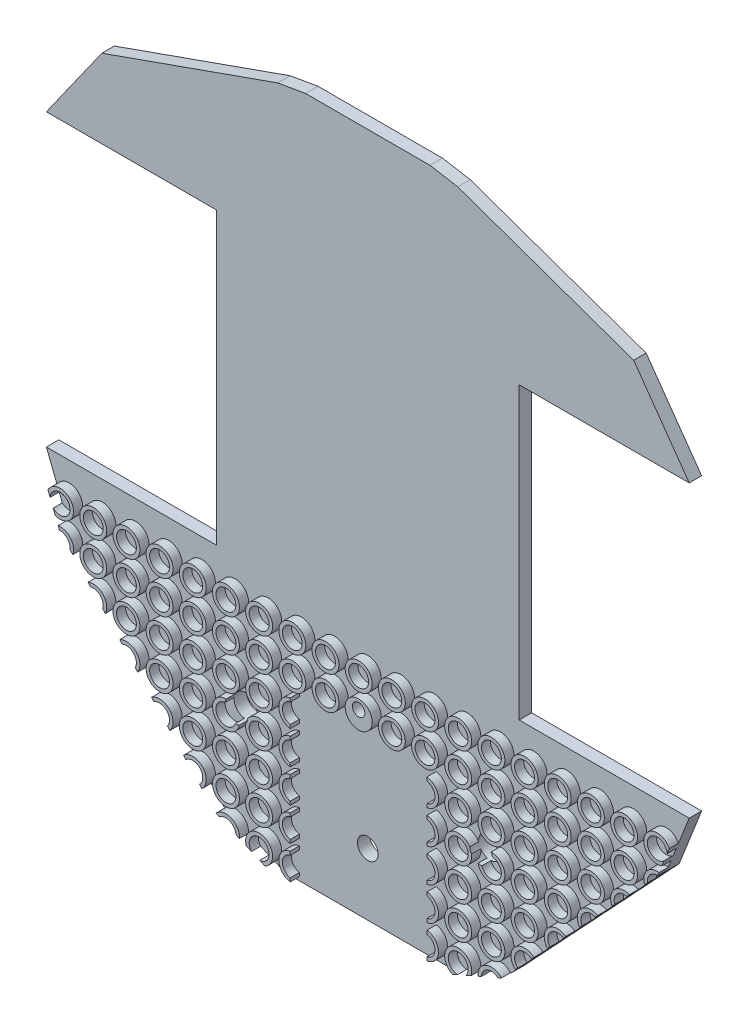
from build123d import *

# Parameters (mm, degrees)
ESBO_O1_W                   = 20.07664266
ESBO_O1_H                   = 70
ESBO_O1_W_2                 = 40
ESBO_O1_H_2                 = 20.07664266
ESBO_O1_W_3                 = 30
RESSALTO_EXTRUS_O1_DEPTH    = 3
ESBO_O2_W                   = 20.003049531
ESBO_O2_H                   = 70
ESBO_O2_W_2                 = 21
ESBO_O2_H_2                 = 35
CORTE_EXTRUS_O1_DEPTH       = 123.700002715
ESBO_O3_R                   = 1.5
ESBO_O3_R_2                 = 2.5
ESBO_O3_R_3                 = 2.75
CORTE_EXTRUS_O2_DEPTH       = 123.700002715
ESBO_O5_R                   = 3.255
ESBO_O5_R_2                 = 2.4
RESSALTO_EXTRUS_O2_DEPTH    = 2.2
CORTE_EXTRUS_O3_OUTLINE_R   = 3.255
CORTE_EXTRUS_O3_OUTLINE_R_2 = 2.4
CORTE_EXTRUS_O3_DEPTH       = 2.2
CORTE_EXTRUS_O4_START       = -28.2
ESBO_O8_R                   = 2.75
ESBO_O8_R_2                 = 1.5
CORTE_EXTRUS_O4_DEPTH       = 28.2


# Read off the part's stored shape, not the designer's step: Corte-extrusão3
with BuildPart() as part:
    # Esboço1 → Ressalto-extrusão1 (new body)
    with BuildSketch(Plane.XY):
        Polygon((-21.69221422, 68.928440225), (-15, 50), (-57.426406871, 35), (-64.118621091, 53.928440225), align=None)
        Polygon((-57.426406871, 35), (-64.118621091, 53.928440225), (-77.503049531, 35), align=None)
        with Locations((-67.464728201, 0)):
            Rectangle(ESBO_O1_W, ESBO_O1_H)
        Polygon((-77.503049531, -35), (-57.426406871, -35), (-72.086515595, -48.716879846), align=None)
        Polygon((-72.086515595, -48.716879846), (-34.660108723, -88.716879846), (-20, -75), (-57.426406871, -35), align=None)
        Polygon((-57.426406871, 0), (0, 0), (0, 50), (-15, 50), (-57.426406871, 35), align=None)
        Polygon((-34.660108723, -88.716879846), (-20, -75), (-20, -95.07664266), align=None)
        Polygon((0, -75), (0, 0), (-57.426406871, 0), (-57.426406871, -35), (-20, -75), align=None)
        with Locations((0, -85.03832133)):
            Rectangle(ESBO_O1_W_2, ESBO_O1_H_2)
        Polygon((0, 50), (0, 0), (0, -75), (20, -75), (57.426406871, -35), (57.426406871, 35), (15, 50), align=None)
        Polygon((34.660108723, -88.716879846), (20, -75), (20, -95.07664266), align=None)
        Polygon((57.426406871, -35), (72.086515595, -48.716879846), (34.660108723, -88.716879846), (20, -75), align=None)
        with Locations((67.464728201, 0)):
            Rectangle(ESBO_O1_W, ESBO_O1_H)
        Polygon((77.503049531, -35), (72.086515595, -48.716879846), (57.426406871, -35), align=None)
        Polygon((57.426406871, 35), (64.118621091, 53.928440225), (77.503049531, 35), align=None)
        Polygon((21.69221422, 68.928440225), (15, 50), (57.426406871, 35), (64.118621091, 53.928440225), align=None)
        with Locations((0, 60.03832133)):
            Rectangle(ESBO_O1_W_3, ESBO_O1_H_2)
        Polygon((15, 50), (15, 70.07664266), (21.69221422, 68.928440225), align=None)
        Polygon((-21.69221422, 68.928440225), (-15, 70.07664266), (-15, 50), align=None)
    extrude(amount=RESSALTO_EXTRUS_O1_DEPTH)

    # Esboço2 → Corte-extrusão1 (cut, through all)
    with BuildSketch(Plane.XY.offset(3)):
        with Locations((-67.501524766, 0)):
            Rectangle(ESBO_O2_W, ESBO_O2_H)
        with Locations((-47, 17.5)):
            Rectangle(ESBO_O2_W_2, ESBO_O2_H_2)
        with Locations((-47, -17.5)):
            Rectangle(ESBO_O2_W_2, ESBO_O2_H_2)
        with Locations((47, 0)):
            Rectangle(ESBO_O2_W_2, ESBO_O2_H)
        with Locations((67.501524766, 0)):
            Rectangle(ESBO_O2_W, ESBO_O2_H)
    extrude(amount=-CORTE_EXTRUS_O1_DEPTH, mode=Mode.SUBTRACT)

    # Esboço3 → Corte-extrusão2 (cut, through all)
    with BuildSketch(Plane.XY.offset(3)):
        with Locations((0, -50)):
            Circle(ESBO_O3_R)
        with Locations((0, -80.07664266)):
            Circle(ESBO_O3_R_2)
        with Locations((-29.5, -65)):
            Circle(ESBO_O3_R_3)
        with Locations((29.5, -65)):
            Circle(ESBO_O3_R_3)
    extrude(amount=-CORTE_EXTRUS_O2_DEPTH, mode=Mode.SUBTRACT)

    # Esboço5 → Ressalto-extrusão2 (add)
    # profile 1 of 133: a face of its own
    with BuildSketch(Plane.XY.offset(3)):
        with Locations((0, -43.002961071)):
            Circle(ESBO_O5_R)
        with Locations((0, -43.002961071)):
            Circle(ESBO_O5_R_2, mode=Mode.SUBTRACT)
    # profile 2 of 133: a face of its own
    with BuildSketch(Plane.XY.offset(3)):
        with Locations((8, -43.002961071)):
            Circle(ESBO_O5_R)
        with Locations((8, -43.002961071)):
            Circle(ESBO_O5_R_2, mode=Mode.SUBTRACT)
    # profile 3 of 133: a face of its own
    with BuildSketch(Plane.XY.offset(3)):
        with Locations((16, -43.002961071)):
            Circle(ESBO_O5_R)
        with Locations((16, -43.002961071)):
            Circle(ESBO_O5_R_2, mode=Mode.SUBTRACT)
    # profile 4 of 133: a face of its own
    with BuildSketch(Plane.XY.offset(3)):
        with Locations((24, -43.002961071)):
            Circle(ESBO_O5_R)
        with Locations((24, -43.002961071)):
            Circle(ESBO_O5_R_2, mode=Mode.SUBTRACT)
    # profile 5 of 133: a face of its own
    with BuildSketch(Plane.XY.offset(3)):
        with Locations((32, -43.002961071)):
            Circle(ESBO_O5_R)
        with Locations((32, -43.002961071)):
            Circle(ESBO_O5_R_2, mode=Mode.SUBTRACT)
    # profile 6 of 133: a face of its own
    with BuildSketch(Plane.XY.offset(3)):
        with Locations((40, -43.002961071)):
            Circle(ESBO_O5_R)
        with Locations((40, -43.002961071)):
            Circle(ESBO_O5_R_2, mode=Mode.SUBTRACT)
    # profile 7 of 133: a face of its own
    with BuildSketch(Plane.XY.offset(3)):
        with Locations((48, -43.002961071)):
            Circle(ESBO_O5_R)
        with Locations((48, -43.002961071)):
            Circle(ESBO_O5_R_2, mode=Mode.SUBTRACT)
    # profile 8 of 133: a face of its own
    with BuildSketch(Plane.XY.offset(3)):
        with Locations((56, -43.002961071)):
            Circle(ESBO_O5_R)
        with Locations((56, -43.002961071)):
            Circle(ESBO_O5_R_2, mode=Mode.SUBTRACT)
    # profile 9 of 133: a face of its own
    with BuildSketch(Plane.XY.offset(3)):
        with Locations((64, -43.002961071)):
            Circle(ESBO_O5_R)
        with Locations((64, -43.002961071)):
            Circle(ESBO_O5_R_2, mode=Mode.SUBTRACT)
    # profile 10 of 133: a face of its own
    with BuildSketch(Plane.XY.offset(3)):
        with Locations(Location((72, -43.002961071, 0), (0, 0, 290.477256302))):
            Circle(ESBO_O5_R)
        with Locations(Location((72, -43.002961071, 0), (0, 0, 313.676093483))):
            Circle(ESBO_O5_R_2, mode=Mode.SUBTRACT)
    # profile 11 of 133: a face of its own
    with BuildSketch(Plane.XY.offset(3)):
        with Locations((8, -51.002961071)):
            Circle(ESBO_O5_R)
        with Locations((8, -51.002961071)):
            Circle(ESBO_O5_R_2, mode=Mode.SUBTRACT)
    # profile 12 of 133: a face of its own
    with BuildSketch(Plane.XY.offset(3)):
        with Locations((16, -51.002961071)):
            Circle(ESBO_O5_R)
        with Locations((16, -51.002961071)):
            Circle(ESBO_O5_R_2, mode=Mode.SUBTRACT)
    # profile 13 of 133: a face of its own
    with BuildSketch(Plane.XY.offset(3)):
        with Locations((24, -51.002961071)):
            Circle(ESBO_O5_R)
        with Locations((24, -51.002961071)):
            Circle(ESBO_O5_R_2, mode=Mode.SUBTRACT)
    # profile 14 of 133: a face of its own
    with BuildSketch(Plane.XY.offset(3)):
        with Locations((32, -51.002961071)):
            Circle(ESBO_O5_R)
        with Locations((32, -51.002961071)):
            Circle(ESBO_O5_R_2, mode=Mode.SUBTRACT)
    # profile 15 of 133: a face of its own
    with BuildSketch(Plane.XY.offset(3)):
        with Locations((40, -51.002961071)):
            Circle(ESBO_O5_R)
        with Locations((40, -51.002961071)):
            Circle(ESBO_O5_R_2, mode=Mode.SUBTRACT)
    # profile 16 of 133: a face of its own
    with BuildSketch(Plane.XY.offset(3)):
        with Locations((48, -51.002961071)):
            Circle(ESBO_O5_R)
        with Locations((48, -51.002961071)):
            Circle(ESBO_O5_R_2, mode=Mode.SUBTRACT)
    # profile 17 of 133: a face of its own
    with BuildSketch(Plane.XY.offset(3)):
        with Locations((56, -51.002961071)):
            Circle(ESBO_O5_R)
        with Locations((56, -51.002961071)):
            Circle(ESBO_O5_R_2, mode=Mode.SUBTRACT)
    # profile 18 of 133: a face of its own
    with BuildSketch(Plane.XY.offset(3)):
        with Locations((64, -51.002961071)):
            Circle(ESBO_O5_R)
        with Locations((64, -51.002961071)):
            Circle(ESBO_O5_R_2, mode=Mode.SUBTRACT)
    # profile 19 of 133: a face of its own
    with BuildSketch(Plane.XY.offset(3)):
        with Locations(Location((72, -51.002961071, 0), (0, 0, 199.488200522))):
            Circle(ESBO_O5_R)
        with Locations(Location((72, -51.002961071, 0), (0, 0, 188.260244767))):
            Circle(ESBO_O5_R_2, mode=Mode.SUBTRACT)
    # profile 20 of 133: a face of its own
    with BuildSketch(Plane.XY.offset(3)):
        with Locations((8, -59.002961071)):
            Circle(ESBO_O5_R)
        with Locations((8, -59.002961071)):
            Circle(ESBO_O5_R_2, mode=Mode.SUBTRACT)
    # profile 21 of 133: a face of its own
    with BuildSketch(Plane.XY.offset(3)):
        with Locations((16, -59.002961071)):
            Circle(ESBO_O5_R)
        with Locations((16, -59.002961071)):
            Circle(ESBO_O5_R_2, mode=Mode.SUBTRACT)
    # profile 22 of 133: a face of its own
    with BuildSketch(Plane.XY.offset(3)):
        with Locations((24, -59.002961071)):
            Circle(ESBO_O5_R)
        with Locations((24, -59.002961071)):
            Circle(ESBO_O5_R_2, mode=Mode.SUBTRACT)
    # profile 23 of 133: a face of its own
    with BuildSketch(Plane.XY.offset(3)):
        with Locations((32, -59.002961071)):
            Circle(ESBO_O5_R)
        with Locations((32, -59.002961071)):
            Circle(ESBO_O5_R_2, mode=Mode.SUBTRACT)
    # profile 24 of 133: a face of its own
    with BuildSketch(Plane.XY.offset(3)):
        with Locations((40, -59.002961071)):
            Circle(ESBO_O5_R)
        with Locations((40, -59.002961071)):
            Circle(ESBO_O5_R_2, mode=Mode.SUBTRACT)
    # profile 25 of 133: a face of its own
    with BuildSketch(Plane.XY.offset(3)):
        with Locations((48, -59.002961071)):
            Circle(ESBO_O5_R)
        with Locations((48, -59.002961071)):
            Circle(ESBO_O5_R_2, mode=Mode.SUBTRACT)
    # profile 26 of 133: a face of its own
    with BuildSketch(Plane.XY.offset(3)):
        with Locations((56, -59.002961071)):
            Circle(ESBO_O5_R)
        with Locations((56, -59.002961071)):
            Circle(ESBO_O5_R_2, mode=Mode.SUBTRACT)
    # profile 27 of 133: a face of its own
    with BuildSketch(Plane.XY.offset(3)):
        with Locations(Location((64, -59.002961071, 0), (0, 0, 206.723675231))):
            Circle(ESBO_O5_R)
        with Locations(Location((64, -59.002961071, 0), (0, 0, 199.007749565))):
            Circle(ESBO_O5_R_2, mode=Mode.SUBTRACT)
    # profile 28 of 133: a face of its own
    with BuildSketch(Plane.XY.offset(3)):
        with Locations((72, -59.002961071)):
            Circle(ESBO_O5_R)
        with Locations((72, -59.002961071)):
            Circle(ESBO_O5_R_2, mode=Mode.SUBTRACT)
    # profile 29 of 133: a face of its own
    with BuildSketch(Plane.XY.offset(3)):
        with Locations((8, -67.002961071)):
            Circle(ESBO_O5_R)
        with Locations((8, -67.002961071)):
            Circle(ESBO_O5_R_2, mode=Mode.SUBTRACT)
    # profile 30 of 133: a face of its own
    with BuildSketch(Plane.XY.offset(3)):
        with Locations((16, -67.002961071)):
            Circle(ESBO_O5_R)
        with Locations((16, -67.002961071)):
            Circle(ESBO_O5_R_2, mode=Mode.SUBTRACT)
    # profile 31 of 133: a face of its own
    with BuildSketch(Plane.XY.offset(3)):
        with Locations(Location((24, -67.002961071, 0), (0, 0, 31.852518549))):
            Circle(ESBO_O5_R)
        with Locations((24, -67.002961071)):
            Circle(ESBO_O5_R_2, mode=Mode.SUBTRACT)
    # profile 32 of 133: a face of its own
    with BuildSketch(Plane.XY.offset(3)):
        with Locations(Location((32, -67.002961071, 0), (0, 0, 191.693843813))):
            Circle(ESBO_O5_R)
        with Locations(Location((32, -67.002961071, 0), (0, 0, 197.921366549))):
            Circle(ESBO_O5_R_2, mode=Mode.SUBTRACT)
    # profile 33 of 133: a face of its own
    with BuildSketch(Plane.XY.offset(3)):
        with Locations((40, -67.002961071)):
            Circle(ESBO_O5_R)
        with Locations((40, -67.002961071)):
            Circle(ESBO_O5_R_2, mode=Mode.SUBTRACT)
    # profile 34 of 133: a face of its own
    with BuildSketch(Plane.XY.offset(3)):
        with Locations((48, -67.002961071)):
            Circle(ESBO_O5_R)
        with Locations((48, -67.002961071)):
            Circle(ESBO_O5_R_2, mode=Mode.SUBTRACT)
    # profile 35 of 133: a face of its own
    with BuildSketch(Plane.XY.offset(3)):
        with Locations(Location((56, -67.002961071, 0), (0, 0, 213.635942436))):
            Circle(ESBO_O5_R)
        with Locations(Location((56, -67.002961071, 0), (0, 0, 208.768363454))):
            Circle(ESBO_O5_R_2, mode=Mode.SUBTRACT)
    # profile 36 of 133: a face of its own
    with BuildSketch(Plane.XY.offset(3)):
        with Locations((64, -67.002961071)):
            Circle(ESBO_O5_R)
        with Locations((64, -67.002961071)):
            Circle(ESBO_O5_R_2, mode=Mode.SUBTRACT)
    # profile 37 of 133: a face of its own
    with BuildSketch(Plane.XY.offset(3)):
        with Locations((72, -67.002961071)):
            Circle(ESBO_O5_R)
        with Locations((72, -67.002961071)):
            Circle(ESBO_O5_R_2, mode=Mode.SUBTRACT)
    # profile 38 of 133: a face of its own
    with BuildSketch(Plane.XY.offset(3)):
        with Locations((8, -75.002961071)):
            Circle(ESBO_O5_R)
        with Locations((8, -75.002961071)):
            Circle(ESBO_O5_R_2, mode=Mode.SUBTRACT)
    # profile 39 of 133: a face of its own
    with BuildSketch(Plane.XY.offset(3)):
        with Locations((16, -75.002961071)):
            Circle(ESBO_O5_R)
        with Locations((16, -75.002961071)):
            Circle(ESBO_O5_R_2, mode=Mode.SUBTRACT)
    # profile 40 of 133: a face of its own
    with BuildSketch(Plane.XY.offset(3)):
        with Locations((24, -75.002961071)):
            Circle(ESBO_O5_R)
        with Locations((24, -75.002961071)):
            Circle(ESBO_O5_R_2, mode=Mode.SUBTRACT)
    # profile 41 of 133: a face of its own
    with BuildSketch(Plane.XY.offset(3)):
        with Locations((32, -75.002961071)):
            Circle(ESBO_O5_R)
        with Locations((32, -75.002961071)):
            Circle(ESBO_O5_R_2, mode=Mode.SUBTRACT)
    # profile 42 of 133: a face of its own
    with BuildSketch(Plane.XY.offset(3)):
        with Locations((40, -75.002961071)):
            Circle(ESBO_O5_R)
        with Locations((40, -75.002961071)):
            Circle(ESBO_O5_R_2, mode=Mode.SUBTRACT)
    # profile 43 of 133: a face of its own
    with BuildSketch(Plane.XY.offset(3)):
        with Locations(Location((48, -75.002961071, 0), (0, 0, 220.355838596))):
            Circle(ESBO_O5_R)
        with Locations(Location((48, -75.002961071, 0), (0, 0, 218.006745936))):
            Circle(ESBO_O5_R_2, mode=Mode.SUBTRACT)
    # profile 44 of 133: a face of its own
    with BuildSketch(Plane.XY.offset(3)):
        with Locations((56, -75.002961071)):
            Circle(ESBO_O5_R)
        with Locations((56, -75.002961071)):
            Circle(ESBO_O5_R_2, mode=Mode.SUBTRACT)
    # profile 45 of 133: a face of its own
    with BuildSketch(Plane.XY.offset(3)):
        with Locations((64, -75.002961071)):
            Circle(ESBO_O5_R)
        with Locations((64, -75.002961071)):
            Circle(ESBO_O5_R_2, mode=Mode.SUBTRACT)
    # profile 46 of 133: a face of its own
    with BuildSketch(Plane.XY.offset(3)):
        with Locations((72, -75.002961071)):
            Circle(ESBO_O5_R)
        with Locations((72, -75.002961071)):
            Circle(ESBO_O5_R_2, mode=Mode.SUBTRACT)
    # profile 47 of 133: a face of its own
    with BuildSketch(Plane.XY.offset(3)):
        with Locations((8, -83.002961071)):
            Circle(ESBO_O5_R)
        with Locations((8, -83.002961071)):
            Circle(ESBO_O5_R_2, mode=Mode.SUBTRACT)
    # profile 48 of 133: a face of its own
    with BuildSketch(Plane.XY.offset(3)):
        with Locations((16, -83.002961071)):
            Circle(ESBO_O5_R)
        with Locations((16, -83.002961071)):
            Circle(ESBO_O5_R_2, mode=Mode.SUBTRACT)
    # profile 49 of 133: a face of its own
    with BuildSketch(Plane.XY.offset(3)):
        with Locations((24, -83.002961071)):
            Circle(ESBO_O5_R)
        with Locations((24, -83.002961071)):
            Circle(ESBO_O5_R_2, mode=Mode.SUBTRACT)
    # profile 50 of 133: a face of its own
    with BuildSketch(Plane.XY.offset(3)):
        with Locations((32, -83.002961071)):
            Circle(ESBO_O5_R)
        with Locations((32, -83.002961071)):
            Circle(ESBO_O5_R_2, mode=Mode.SUBTRACT)
    # profile 51 of 133: a face of its own
    with BuildSketch(Plane.XY.offset(3)):
        with Locations(Location((40, -83.002961071, 0), (0, 0, 226.985962702))):
            Circle(ESBO_O5_R)
        with Locations(Location((40, -83.002961071, 0), (0, 0, 227.015245336))):
            Circle(ESBO_O5_R_2, mode=Mode.SUBTRACT)
    # profile 52 of 133: a face of its own
    with BuildSketch(Plane.XY.offset(3)):
        with Locations((48, -83.002961071)):
            Circle(ESBO_O5_R)
        with Locations((48, -83.002961071)):
            Circle(ESBO_O5_R_2, mode=Mode.SUBTRACT)
    # profile 53 of 133: a face of its own
    with BuildSketch(Plane.XY.offset(3)):
        with Locations((56, -83.002961071)):
            Circle(ESBO_O5_R)
        with Locations((56, -83.002961071)):
            Circle(ESBO_O5_R_2, mode=Mode.SUBTRACT)
    # profile 54 of 133: a face of its own
    with BuildSketch(Plane.XY.offset(3)):
        with Locations((64, -83.002961071)):
            Circle(ESBO_O5_R)
        with Locations((64, -83.002961071)):
            Circle(ESBO_O5_R_2, mode=Mode.SUBTRACT)
    # profile 55 of 133: a face of its own
    with BuildSketch(Plane.XY.offset(3)):
        with Locations((72, -83.002961071)):
            Circle(ESBO_O5_R)
        with Locations((72, -83.002961071)):
            Circle(ESBO_O5_R_2, mode=Mode.SUBTRACT)
    # profile 56 of 133: a face of its own
    with BuildSketch(Plane.XY.offset(3)):
        with Locations((0, -51.002961071)):
            Circle(ESBO_O5_R)
    # profile 57 of 133: a face of its own
    with BuildSketch(Plane.XY.offset(3)):
        with Locations((0, -59.002961071)):
            Circle(ESBO_O5_R)
    # profile 58 of 133: a face of its own
    with BuildSketch(Plane.XY.offset(3)):
        with Locations((0, -67.002961071)):
            Circle(ESBO_O5_R)
    # profile 59 of 133: a face of its own
    with BuildSketch(Plane.XY.offset(3)):
        with Locations(Location((0, -75.002961071, 0), (0, 0, 245.632318391))):
            Circle(ESBO_O5_R)
    # profile 60 of 133: a face of its own
    with BuildSketch(Plane.XY.offset(3)):
        with Locations(Location((0, -83.002961071, 0), (0, 0, 137.344194985))):
            Circle(ESBO_O5_R)
    # profile 61 of 133: a face of its own
    with BuildSketch(Plane.XY.offset(3)):
        with Locations((-8, -43.002961071)):
            Circle(ESBO_O5_R)
        with Locations((-8, -43.002961071)):
            Circle(ESBO_O5_R_2, mode=Mode.SUBTRACT)
    # profile 62 of 133: a face of its own
    with BuildSketch(Plane.XY.offset(3)):
        with Locations((-16, -43.002961071)):
            Circle(ESBO_O5_R)
        with Locations((-16, -43.002961071)):
            Circle(ESBO_O5_R_2, mode=Mode.SUBTRACT)
    # profile 63 of 133: a face of its own
    with BuildSketch(Plane.XY.offset(3)):
        with Locations((-24, -43.002961071)):
            Circle(ESBO_O5_R)
        with Locations((-24, -43.002961071)):
            Circle(ESBO_O5_R_2, mode=Mode.SUBTRACT)
    # profile 64 of 133: a face of its own
    with BuildSketch(Plane.XY.offset(3)):
        with Locations((-32, -43.002961071)):
            Circle(ESBO_O5_R)
        with Locations((-32, -43.002961071)):
            Circle(ESBO_O5_R_2, mode=Mode.SUBTRACT)
    # profile 65 of 133: a face of its own
    with BuildSketch(Plane.XY.offset(3)):
        with Locations((-40, -43.002961071)):
            Circle(ESBO_O5_R)
        with Locations((-40, -43.002961071)):
            Circle(ESBO_O5_R_2, mode=Mode.SUBTRACT)
    # profile 66 of 133: a face of its own
    with BuildSketch(Plane.XY.offset(3)):
        with Locations((-48, -43.002961071)):
            Circle(ESBO_O5_R)
        with Locations((-48, -43.002961071)):
            Circle(ESBO_O5_R_2, mode=Mode.SUBTRACT)
    # profile 67 of 133: a face of its own
    with BuildSketch(Plane.XY.offset(3)):
        with Locations((-56, -43.002961071)):
            Circle(ESBO_O5_R)
        with Locations((-56, -43.002961071)):
            Circle(ESBO_O5_R_2, mode=Mode.SUBTRACT)
    # profile 68 of 133: a face of its own
    with BuildSketch(Plane.XY.offset(3)):
        with Locations((-64, -43.002961071)):
            Circle(ESBO_O5_R)
        with Locations((-64, -43.002961071)):
            Circle(ESBO_O5_R_2, mode=Mode.SUBTRACT)
    # profile 69 of 133: a face of its own
    with BuildSketch(Plane.XY.offset(3)):
        with Locations(Location((-72, -43.002961071, 0), (0, 0, 153.573490378))):
            Circle(ESBO_O5_R)
        with Locations(Location((-72, -43.002961071, 0), (0, 0, 176.772327558))):
            Circle(ESBO_O5_R_2, mode=Mode.SUBTRACT)
    # profile 70 of 133: a face of its own
    with BuildSketch(Plane.XY.offset(3)):
        with Locations((-8, -51.002961071)):
            Circle(ESBO_O5_R)
        with Locations((-8, -51.002961071)):
            Circle(ESBO_O5_R_2, mode=Mode.SUBTRACT)
    # profile 71 of 133: a face of its own
    with BuildSketch(Plane.XY.offset(3)):
        with Locations((-16, -51.002961071)):
            Circle(ESBO_O5_R)
        with Locations((-16, -51.002961071)):
            Circle(ESBO_O5_R_2, mode=Mode.SUBTRACT)
    # profile 72 of 133: a face of its own
    with BuildSketch(Plane.XY.offset(3)):
        with Locations((-24, -51.002961071)):
            Circle(ESBO_O5_R)
        with Locations((-24, -51.002961071)):
            Circle(ESBO_O5_R_2, mode=Mode.SUBTRACT)
    # profile 73 of 133: a face of its own
    with BuildSketch(Plane.XY.offset(3)):
        with Locations((-32, -51.002961071)):
            Circle(ESBO_O5_R)
        with Locations((-32, -51.002961071)):
            Circle(ESBO_O5_R_2, mode=Mode.SUBTRACT)
    # profile 74 of 133: a face of its own
    with BuildSketch(Plane.XY.offset(3)):
        with Locations((-40, -51.002961071)):
            Circle(ESBO_O5_R)
        with Locations((-40, -51.002961071)):
            Circle(ESBO_O5_R_2, mode=Mode.SUBTRACT)
    # profile 75 of 133: a face of its own
    with BuildSketch(Plane.XY.offset(3)):
        with Locations((-48, -51.002961071)):
            Circle(ESBO_O5_R)
        with Locations((-48, -51.002961071)):
            Circle(ESBO_O5_R_2, mode=Mode.SUBTRACT)
    # profile 76 of 133: a face of its own
    with BuildSketch(Plane.XY.offset(3)):
        with Locations((-56, -51.002961071)):
            Circle(ESBO_O5_R)
        with Locations((-56, -51.002961071)):
            Circle(ESBO_O5_R_2, mode=Mode.SUBTRACT)
    # profile 77 of 133: a face of its own
    with BuildSketch(Plane.XY.offset(3)):
        with Locations((-64, -51.002961071)):
            Circle(ESBO_O5_R)
        with Locations((-64, -51.002961071)):
            Circle(ESBO_O5_R_2, mode=Mode.SUBTRACT)
    # profile 78 of 133: a face of its own
    with BuildSketch(Plane.XY.offset(3)):
        with Locations(Location((-72, -51.002961071, 0), (0, 0, 98.060717709))):
            Circle(ESBO_O5_R)
        with Locations(Location((-72, -51.002961071, 0), (0, 0, 93.107583305))):
            Circle(ESBO_O5_R_2, mode=Mode.SUBTRACT)
    # profile 79 of 133: a face of its own
    with BuildSketch(Plane.XY.offset(3)):
        with Locations((-8, -59.002961071)):
            Circle(ESBO_O5_R)
        with Locations((-8, -59.002961071)):
            Circle(ESBO_O5_R_2, mode=Mode.SUBTRACT)
    # profile 80 of 133: a face of its own
    with BuildSketch(Plane.XY.offset(3)):
        with Locations((-16, -59.002961071)):
            Circle(ESBO_O5_R)
        with Locations((-16, -59.002961071)):
            Circle(ESBO_O5_R_2, mode=Mode.SUBTRACT)
    # profile 81 of 133: a face of its own
    with BuildSketch(Plane.XY.offset(3)):
        with Locations((-24, -59.002961071)):
            Circle(ESBO_O5_R)
        with Locations((-24, -59.002961071)):
            Circle(ESBO_O5_R_2, mode=Mode.SUBTRACT)
    # profile 82 of 133: a face of its own
    with BuildSketch(Plane.XY.offset(3)):
        with Locations((-32, -59.002961071)):
            Circle(ESBO_O5_R)
        with Locations((-32, -59.002961071)):
            Circle(ESBO_O5_R_2, mode=Mode.SUBTRACT)
    # profile 83 of 133: a face of its own
    with BuildSketch(Plane.XY.offset(3)):
        with Locations((-40, -59.002961071)):
            Circle(ESBO_O5_R)
        with Locations((-40, -59.002961071)):
            Circle(ESBO_O5_R_2, mode=Mode.SUBTRACT)
    # profile 84 of 133: a face of its own
    with BuildSketch(Plane.XY.offset(3)):
        with Locations((-48, -59.002961071)):
            Circle(ESBO_O5_R)
        with Locations((-48, -59.002961071)):
            Circle(ESBO_O5_R_2, mode=Mode.SUBTRACT)
    # profile 85 of 133: a face of its own
    with BuildSketch(Plane.XY.offset(3)):
        with Locations((-56, -59.002961071)):
            Circle(ESBO_O5_R)
        with Locations((-56, -59.002961071)):
            Circle(ESBO_O5_R_2, mode=Mode.SUBTRACT)
    # profile 86 of 133: a face of its own
    with BuildSketch(Plane.XY.offset(3)):
        with Locations(Location((-64, -59.002961071, 0), (0, 0, 112.916143382))):
            Circle(ESBO_O5_R)
        with Locations(Location((-64, -59.002961071, 0), (0, 0, 105.200217716))):
            Circle(ESBO_O5_R_2, mode=Mode.SUBTRACT)
    # profile 87 of 133: a face of its own
    with BuildSketch(Plane.XY.offset(3)):
        with Locations((-72, -59.002961071)):
            Circle(ESBO_O5_R)
        with Locations((-72, -59.002961071)):
            Circle(ESBO_O5_R_2, mode=Mode.SUBTRACT)
    # profile 88 of 133: a face of its own
    with BuildSketch(Plane.XY.offset(3)):
        with Locations((-8, -67.002961071)):
            Circle(ESBO_O5_R)
        with Locations((-8, -67.002961071)):
            Circle(ESBO_O5_R_2, mode=Mode.SUBTRACT)
    # profile 89 of 133: a face of its own
    with BuildSketch(Plane.XY.offset(3)):
        with Locations((-16, -67.002961071)):
            Circle(ESBO_O5_R)
        with Locations((-16, -67.002961071)):
            Circle(ESBO_O5_R_2, mode=Mode.SUBTRACT)
    # profile 90 of 133: a face of its own
    with BuildSketch(Plane.XY.offset(3)):
        with Locations(Location((-24, -67.002961071, 0), (0, 0, 171.83182659))):
            Circle(ESBO_O5_R)
        with Locations((-24, -67.002961071)):
            Circle(ESBO_O5_R_2, mode=Mode.SUBTRACT)
    # profile 91 of 133: a face of its own
    with BuildSketch(Plane.XY.offset(3)):
        with Locations(Location((-32, -67.002961071, 0), (0, 0, 89.096171969))):
            Circle(ESBO_O5_R)
        with Locations(Location((-32, -67.002961071, 0), (0, 0, 95.323694705))):
            Circle(ESBO_O5_R_2, mode=Mode.SUBTRACT)
    # profile 92 of 133: a face of its own
    with BuildSketch(Plane.XY.offset(3)):
        with Locations((-40, -67.002961071)):
            Circle(ESBO_O5_R)
        with Locations((-40, -67.002961071)):
            Circle(ESBO_O5_R_2, mode=Mode.SUBTRACT)
    # profile 93 of 133: a face of its own
    with BuildSketch(Plane.XY.offset(3)):
        with Locations((-48, -67.002961071)):
            Circle(ESBO_O5_R)
        with Locations((-48, -67.002961071)):
            Circle(ESBO_O5_R_2, mode=Mode.SUBTRACT)
    # profile 94 of 133: a face of its own
    with BuildSketch(Plane.XY.offset(3)):
        with Locations(Location((-56, -67.002961071, 0), (0, 0, 119.828410587))):
            Circle(ESBO_O5_R)
        with Locations(Location((-56, -67.002961071, 0), (0, 0, 114.960831605))):
            Circle(ESBO_O5_R_2, mode=Mode.SUBTRACT)
    # profile 95 of 133: a face of its own
    with BuildSketch(Plane.XY.offset(3)):
        with Locations((-64, -67.002961071)):
            Circle(ESBO_O5_R)
        with Locations((-64, -67.002961071)):
            Circle(ESBO_O5_R_2, mode=Mode.SUBTRACT)
    # profile 96 of 133: a face of its own
    with BuildSketch(Plane.XY.offset(3)):
        with Locations((-72, -67.002961071)):
            Circle(ESBO_O5_R)
        with Locations((-72, -67.002961071)):
            Circle(ESBO_O5_R_2, mode=Mode.SUBTRACT)
    # profile 97 of 133: a face of its own
    with BuildSketch(Plane.XY.offset(3)):
        with Locations((-8, -75.002961071)):
            Circle(ESBO_O5_R)
        with Locations((-8, -75.002961071)):
            Circle(ESBO_O5_R_2, mode=Mode.SUBTRACT)
    # profile 98 of 133: a face of its own
    with BuildSketch(Plane.XY.offset(3)):
        with Locations((-16, -75.002961071)):
            Circle(ESBO_O5_R)
        with Locations((-16, -75.002961071)):
            Circle(ESBO_O5_R_2, mode=Mode.SUBTRACT)
    # profile 99 of 133: a face of its own
    with BuildSketch(Plane.XY.offset(3)):
        with Locations((-24, -75.002961071)):
            Circle(ESBO_O5_R)
        with Locations((-24, -75.002961071)):
            Circle(ESBO_O5_R_2, mode=Mode.SUBTRACT)
    # profile 100 of 133: a face of its own
    with BuildSketch(Plane.XY.offset(3)):
        with Locations((-32, -75.002961071)):
            Circle(ESBO_O5_R)
        with Locations((-32, -75.002961071)):
            Circle(ESBO_O5_R_2, mode=Mode.SUBTRACT)
    # profile 101 of 133: a face of its own
    with BuildSketch(Plane.XY.offset(3)):
        with Locations((-40, -75.002961071)):
            Circle(ESBO_O5_R)
        with Locations((-40, -75.002961071)):
            Circle(ESBO_O5_R_2, mode=Mode.SUBTRACT)
    # profile 102 of 133: a face of its own
    with BuildSketch(Plane.XY.offset(3)):
        with Locations(Location((-48, -75.002961071, 0), (0, 0, 126.548306747))):
            Circle(ESBO_O5_R)
        with Locations(Location((-48, -75.002961071, 0), (0, 0, 124.199214087))):
            Circle(ESBO_O5_R_2, mode=Mode.SUBTRACT)
    # profile 103 of 133: a face of its own
    with BuildSketch(Plane.XY.offset(3)):
        with Locations((-56, -75.002961071)):
            Circle(ESBO_O5_R)
        with Locations((-56, -75.002961071)):
            Circle(ESBO_O5_R_2, mode=Mode.SUBTRACT)
    # profile 104 of 133: a face of its own
    with BuildSketch(Plane.XY.offset(3)):
        with Locations((-64, -75.002961071)):
            Circle(ESBO_O5_R)
        with Locations((-64, -75.002961071)):
            Circle(ESBO_O5_R_2, mode=Mode.SUBTRACT)
    # profile 105 of 133: a face of its own
    with BuildSketch(Plane.XY.offset(3)):
        with Locations((-72, -75.002961071)):
            Circle(ESBO_O5_R)
        with Locations((-72, -75.002961071)):
            Circle(ESBO_O5_R_2, mode=Mode.SUBTRACT)
    # profile 106 of 133: a face of its own
    with BuildSketch(Plane.XY.offset(3)):
        with Locations((-8, -83.002961071)):
            Circle(ESBO_O5_R)
        with Locations((-8, -83.002961071)):
            Circle(ESBO_O5_R_2, mode=Mode.SUBTRACT)
    # profile 107 of 133: a face of its own
    with BuildSketch(Plane.XY.offset(3)):
        with Locations((-16, -83.002961071)):
            Circle(ESBO_O5_R)
        with Locations((-16, -83.002961071)):
            Circle(ESBO_O5_R_2, mode=Mode.SUBTRACT)
    # profile 108 of 133: a face of its own
    with BuildSketch(Plane.XY.offset(3)):
        with Locations((-24, -83.002961071)):
            Circle(ESBO_O5_R)
        with Locations((-24, -83.002961071)):
            Circle(ESBO_O5_R_2, mode=Mode.SUBTRACT)
    # profile 109 of 133: a face of its own
    with BuildSketch(Plane.XY.offset(3)):
        with Locations((-32, -83.002961071)):
            Circle(ESBO_O5_R)
        with Locations((-32, -83.002961071)):
            Circle(ESBO_O5_R_2, mode=Mode.SUBTRACT)
    # profile 110 of 133: a face of its own
    with BuildSketch(Plane.XY.offset(3)):
        with Locations(Location((-40, -83.002961071, 0), (0, 0, 133.178430853))):
            Circle(ESBO_O5_R)
        with Locations(Location((-40, -83.002961071, 0), (0, 0, 133.207713487))):
            Circle(ESBO_O5_R_2, mode=Mode.SUBTRACT)
    # profile 111 of 133: a face of its own
    with BuildSketch(Plane.XY.offset(3)):
        with Locations((-48, -83.002961071)):
            Circle(ESBO_O5_R)
        with Locations((-48, -83.002961071)):
            Circle(ESBO_O5_R_2, mode=Mode.SUBTRACT)
    # profile 112 of 133: a face of its own
    with BuildSketch(Plane.XY.offset(3)):
        with Locations((-56, -83.002961071)):
            Circle(ESBO_O5_R)
        with Locations((-56, -83.002961071)):
            Circle(ESBO_O5_R_2, mode=Mode.SUBTRACT)
    # profile 113 of 133: a face of its own
    with BuildSketch(Plane.XY.offset(3)):
        with Locations((-64, -83.002961071)):
            Circle(ESBO_O5_R)
        with Locations((-64, -83.002961071)):
            Circle(ESBO_O5_R_2, mode=Mode.SUBTRACT)
    # profile 114 of 133: a face of its own
    with BuildSketch(Plane.XY.offset(3)):
        with Locations((-72, -83.002961071)):
            Circle(ESBO_O5_R)
        with Locations((-72, -83.002961071)):
            Circle(ESBO_O5_R_2, mode=Mode.SUBTRACT)
    # profile 115 of 133: a face of its own
    with BuildSketch(Plane.XY.offset(3)):
        with Locations((-8, -91.002961071)):
            Circle(ESBO_O5_R)
        with Locations((-8, -91.002961071)):
            Circle(ESBO_O5_R_2, mode=Mode.SUBTRACT)
    # profile 116 of 133: a face of its own
    with BuildSketch(Plane.XY.offset(3)):
        with Locations((-16, -91.002961071)):
            Circle(ESBO_O5_R)
        with Locations((-16, -91.002961071)):
            Circle(ESBO_O5_R_2, mode=Mode.SUBTRACT)
    # profile 117 of 133: a face of its own
    with BuildSketch(Plane.XY.offset(3)):
        with Locations(Location((-24, -91.002961071, 0), (0, 0, 197.776764313))):
            Circle(ESBO_O5_R)
        with Locations(Location((-24, -91.002961071, 0), (0, 0, 219.910195488))):
            Circle(ESBO_O5_R_2, mode=Mode.SUBTRACT)
    # profile 118 of 133: a face of its own
    with BuildSketch(Plane.XY.offset(3)):
        with Locations(Location((-32, -91.002961071, 0), (0, 0, 137.941444936))):
            Circle(ESBO_O5_R)
        with Locations(Location((-32, -91.002961071, 0), (0, 0, 130.906654956))):
            Circle(ESBO_O5_R_2, mode=Mode.SUBTRACT)
    # profile 119 of 133: a face of its own
    with BuildSketch(Plane.XY.offset(3)):
        with Locations((-40, -91.002961071)):
            Circle(ESBO_O5_R)
        with Locations((-40, -91.002961071)):
            Circle(ESBO_O5_R_2, mode=Mode.SUBTRACT)
    # profile 120 of 133: a face of its own
    with BuildSketch(Plane.XY.offset(3)):
        with Locations((-48, -91.002961071)):
            Circle(ESBO_O5_R)
        with Locations((-48, -91.002961071)):
            Circle(ESBO_O5_R_2, mode=Mode.SUBTRACT)
    # profile 121 of 133: a face of its own
    with BuildSketch(Plane.XY.offset(3)):
        with Locations((-56, -91.002961071)):
            Circle(ESBO_O5_R)
        with Locations((-56, -91.002961071)):
            Circle(ESBO_O5_R_2, mode=Mode.SUBTRACT)
    # profile 122 of 133: a face of its own
    with BuildSketch(Plane.XY.offset(3)):
        with Locations((-64, -91.002961071)):
            Circle(ESBO_O5_R)
        with Locations((-64, -91.002961071)):
            Circle(ESBO_O5_R_2, mode=Mode.SUBTRACT)
    # profile 123 of 133: a face of its own
    with BuildSketch(Plane.XY.offset(3)):
        with Locations((-72, -91.002961071)):
            Circle(ESBO_O5_R)
        with Locations((-72, -91.002961071)):
            Circle(ESBO_O5_R_2, mode=Mode.SUBTRACT)
    # profile 124 of 133: a face of its own
    with BuildSketch(Plane.XY.offset(3)):
        with Locations((0, -91.002961071)):
            Circle(ESBO_O5_R)
    # profile 125 of 133: a face of its own
    with BuildSketch(Plane.XY.offset(3)):
        with Locations((8, -91.002961071)):
            Circle(ESBO_O5_R)
        with Locations((8, -91.002961071)):
            Circle(ESBO_O5_R_2, mode=Mode.SUBTRACT)
    # profile 126 of 133: a face of its own
    with BuildSketch(Plane.XY.offset(3)):
        with Locations((16, -91.002961071)):
            Circle(ESBO_O5_R)
        with Locations((16, -91.002961071)):
            Circle(ESBO_O5_R_2, mode=Mode.SUBTRACT)
    # profile 127 of 133: a face of its own
    with BuildSketch(Plane.XY.offset(3)):
        with Locations(Location((24, -91.002961071, 0), (0, 0, 244.680530238))):
            Circle(ESBO_O5_R)
        with Locations(Location((24, -91.002961071, 0), (0, 0, 266.813961412))):
            Circle(ESBO_O5_R_2, mode=Mode.SUBTRACT)
    # profile 128 of 133: a face of its own
    with BuildSketch(Plane.XY.offset(3)):
        with Locations(Location((32, -91.002961071, 0), (0, 0, 184.845210861))):
            Circle(ESBO_O5_R)
        with Locations(Location((32, -91.002961071, 0), (0, 0, 177.81042088))):
            Circle(ESBO_O5_R_2, mode=Mode.SUBTRACT)
    # profile 129 of 133: a face of its own
    with BuildSketch(Plane.XY.offset(3)):
        with Locations((40, -91.002961071)):
            Circle(ESBO_O5_R)
        with Locations((40, -91.002961071)):
            Circle(ESBO_O5_R_2, mode=Mode.SUBTRACT)
    # profile 130 of 133: a face of its own
    with BuildSketch(Plane.XY.offset(3)):
        with Locations((48, -91.002961071)):
            Circle(ESBO_O5_R)
        with Locations((48, -91.002961071)):
            Circle(ESBO_O5_R_2, mode=Mode.SUBTRACT)
    # profile 131 of 133: a face of its own
    with BuildSketch(Plane.XY.offset(3)):
        with Locations((56, -91.002961071)):
            Circle(ESBO_O5_R)
        with Locations((56, -91.002961071)):
            Circle(ESBO_O5_R_2, mode=Mode.SUBTRACT)
    # profile 132 of 133: a face of its own
    with BuildSketch(Plane.XY.offset(3)):
        with Locations((64, -91.002961071)):
            Circle(ESBO_O5_R)
        with Locations((64, -91.002961071)):
            Circle(ESBO_O5_R_2, mode=Mode.SUBTRACT)
    # profile 133 of 133: a face of its own
    with BuildSketch(Plane.XY.offset(3)):
        with Locations((72, -91.002961071)):
            Circle(ESBO_O5_R)
        with Locations((72, -91.002961071)):
            Circle(ESBO_O5_R_2, mode=Mode.SUBTRACT)
    extrude(amount=RESSALTO_EXTRUS_O2_DEPTH)

    # Corte-extrusão3 outline → Corte-extrusão3 (cut)
    # profile 1 of 71: a face of its own
    with BuildSketch(Plane.XY.offset(3)):
        with BuildLine():
            ThreePointArc((-69.624898287, -51.347768049), (-73.771624125, -52.622018809), (-72.130106334, -48.606490261))
            Line((-72.130106334, -48.606490261), (-72.456424021, -47.780120381))
            ThreePointArc((-72.456424021, -47.780120381), (-74.519344262, -53.064011649), (-68.931478249, -52.08887049))
            Line((-68.931478249, -52.08887049), (-69.624898287, -51.347768049))
        make_face()
    # profile 2 of 71: a face of its own
    with BuildSketch(Plane.XY.offset(3)):
        with BuildLine():
            ThreePointArc((-74.914871836, -41.554324754), (-75.027506266, -44.198465487), (-73.138714681, -46.052281303))
            Line((-73.138714681, -46.052281303), (-73.657393667, -44.738773916))
            ThreePointArc((-73.657393667, -44.738773916), (-74.232262684, -43.884438982), (-74.39619285, -42.867832142))
            Line((-74.39619285, -42.867832142), (-74.914871836, -41.554324754))
        make_face()
    # profile 3 of 71: a face of its own
    with BuildSketch(Plane.XY.offset(3)):
        with BuildLine():
            Line((-25.840922393, -92.542767794), (-27.099584446, -91.996742367))
            ThreePointArc((-27.099584446, -91.996742367), (-25.295420932, -93.989080561), (-22.607950242, -93.945276906))
            Line((-22.607950242, -93.945276906), (-23.866612294, -93.399251479))
            ThreePointArc((-23.866612294, -93.399251479), (-24.955149073, -93.204708161), (-25.840922393, -92.542767794))
        make_face()
    # profile 4 of 71: a face of its own
    with BuildSketch(Plane.XY.offset(3)):
        with BuildLine():
            Line((-33.571588646, -89.189095274), (-34.416709254, -88.822469984))
            ThreePointArc((-34.416709254, -88.822469984), (-33.295420931, -93.989080562), (-28.756631675, -91.277891808))
            Line((-28.756631675, -91.277891808), (-29.601752284, -90.911266518))
            ThreePointArc((-29.601752284, -90.911266518), (-32.955149074, -93.204708161), (-33.571588646, -89.189095274))
        make_face()
    # profile 5 of 71: a face of its own
    with BuildSketch(Plane.XY.offset(3)):
        with BuildLine():
            Line((-41.64314857, -81.253657559), (-42.227307428, -80.629329545))
            ThreePointArc((-42.227307428, -80.629329545), (-42.376824387, -85.226860986), (-37.779512175, -85.382973428))
            Line((-37.779512175, -85.382973428), (-38.363671033, -84.758645414))
            ThreePointArc((-38.363671033, -84.758645414), (-41.752497245, -84.642702943), (-41.64314857, -81.253657559))
        make_face()
    # profile 6 of 71: a face of its own
    with BuildSketch(Plane.XY.offset(3)):
        with BuildLine():
            Line((-49.348972879, -73.017949189), (-49.93835353, -72.388040309))
            ThreePointArc((-49.93835353, -72.388040309), (-50.376824387, -77.226860986), (-45.519567523, -77.110680152))
            Line((-45.519567523, -77.110680152), (-46.108948174, -76.480771272))
            ThreePointArc((-46.108948174, -76.480771272), (-49.752497244, -76.642702944), (-49.348972879, -73.017949189))
        make_face()
    # profile 7 of 71: a face of its own
    with BuildSketch(Plane.XY.offset(3)):
        with BuildLine():
            Line((-57.012796629, -64.827129508), (-57.619050634, -64.179186993))
            ThreePointArc((-57.619050634, -64.179186993), (-58.376824388, -69.226860986), (-53.289971869, -68.805950957))
            Line((-53.289971869, -68.805950957), (-53.896225874, -68.158008441))
            ThreePointArc((-53.896225874, -68.158008441), (-57.752497244, -68.642702944), (-57.012796629, -64.827129508))
        make_face()
    # profile 8 of 71: a face of its own
    with BuildSketch(Plane.XY.offset(3)):
        with BuildLine():
            Line((-64.629262829, -56.686923875), (-65.267443239, -56.004859566))
            ThreePointArc((-65.267443239, -56.004859566), (-66.376824387, -61.226860986), (-61.092680714, -60.466695872))
            Line((-61.092680714, -60.466695872), (-61.730861123, -59.784631562))
            ThreePointArc((-61.730861123, -59.784631562), (-65.752497244, -60.642702944), (-64.629262829, -56.686923875))
        make_face()
    # profile 9 of 71: a face of its own
    with BuildSketch(Plane.XY.offset(3)):
        with BuildLine():
            Line((73.657393667, -44.738773916), (73.138714681, -46.052281303))
            ThreePointArc((73.138714681, -46.052281303), (75.027506266, -44.198465487), (74.914871836, -41.554324754))
            Line((74.914871836, -41.554324754), (74.39619285, -42.867832142))
            ThreePointArc((74.39619285, -42.867832142), (74.232262684, -43.884438982), (73.657393667, -44.738773916))
        make_face()
    # profile 10 of 71: a face of its own
    with BuildSketch(Plane.XY.offset(3)):
        with BuildLine():
            Line((69.624898287, -51.347768049), (68.931478249, -52.08887049))
            ThreePointArc((68.931478249, -52.08887049), (74.519344262, -53.064011649), (72.456424021, -47.780120381))
            Line((72.456424021, -47.780120381), (72.130106334, -48.606490261))
            ThreePointArc((72.130106334, -48.606490261), (73.771624125, -52.622018809), (69.624898287, -51.347768049))
        make_face()
    # profile 11 of 71: a face of its own
    with BuildSketch(Plane.XY.offset(3)):
        with BuildLine():
            Line((61.730861123, -59.784631562), (61.092680714, -60.466695872))
            ThreePointArc((61.092680714, -60.466695872), (66.376824387, -61.226860986), (65.267443239, -56.004859566))
            Line((65.267443239, -56.004859566), (64.629262829, -56.686923875))
            ThreePointArc((64.629262829, -56.686923875), (65.752497244, -60.642702944), (61.730861123, -59.784631562))
        make_face()
    # profile 12 of 71: a face of its own
    with BuildSketch(Plane.XY.offset(3)):
        with BuildLine():
            Line((53.896225874, -68.158008441), (53.289971869, -68.805950957))
            ThreePointArc((53.289971869, -68.805950957), (58.376824388, -69.226860986), (57.619050634, -64.179186993))
            Line((57.619050634, -64.179186993), (57.012796629, -64.827129508))
            ThreePointArc((57.012796629, -64.827129508), (57.752497244, -68.642702944), (53.896225874, -68.158008441))
        make_face()
    # profile 13 of 71: a face of its own
    with BuildSketch(Plane.XY.offset(3)):
        with BuildLine():
            Line((46.108948174, -76.480771272), (45.519567523, -77.110680152))
            ThreePointArc((45.519567523, -77.110680152), (50.376824387, -77.226860986), (49.93835353, -72.388040309))
            Line((49.93835353, -72.388040309), (49.348972879, -73.017949189))
            ThreePointArc((49.348972879, -73.017949189), (49.752497244, -76.642702944), (46.108948174, -76.480771272))
        make_face()
    # profile 14 of 71: a face of its own
    with BuildSketch(Plane.XY.offset(3)):
        with BuildLine():
            Line((38.363671033, -84.758645414), (37.779512175, -85.382973428))
            ThreePointArc((37.779512175, -85.382973428), (42.376824387, -85.226860986), (42.227307428, -80.629329545))
            Line((42.227307428, -80.629329545), (41.64314857, -81.253657559))
            ThreePointArc((41.64314857, -81.253657559), (41.752497245, -84.642702943), (38.363671033, -84.758645414))
        make_face()
    # profile 15 of 71: a face of its own
    with BuildSketch(Plane.XY.offset(3)):
        with BuildLine():
            ThreePointArc((22.607950242, -93.945276906), (25.295420932, -93.989080561), (27.099584446, -91.996742367))
            Line((27.099584446, -91.996742367), (25.840922393, -92.542767794))
            ThreePointArc((25.840922393, -92.542767794), (24.955149073, -93.204708161), (23.866612294, -93.399251479))
            Line((23.866612294, -93.399251479), (22.607950242, -93.945276906))
        make_face()
    # profile 16 of 71: a face of its own
    with BuildSketch(Plane.XY.offset(3)):
        with BuildLine():
            ThreePointArc((28.756631675, -91.277891808), (33.295420931, -93.989080562), (34.416709254, -88.822469984))
            Line((34.416709254, -88.822469984), (33.571588646, -89.189095274))
            ThreePointArc((33.571588646, -89.189095274), (32.955149074, -93.204708161), (29.601752284, -90.911266518))
            Line((29.601752284, -90.911266518), (28.756631675, -91.277891808))
        make_face()
    # profile 17 of 71: a face of its own
    with BuildSketch(Plane.XY.offset(3)):
        with BuildLine():
            Line((16.5, -94.219329365), (16.5, -93.35029999))
            ThreePointArc((16.5, -93.35029999), (13.6, -91.002961071), (16.5, -88.655622152))
            Line((16.5, -88.655622152), (16.5, -87.786592777))
            ThreePointArc((16.5, -87.786592777), (12.745, -91.002961071), (16.5, -94.219329365))
        make_face()
    # profile 18 of 71: a face of its own
    with BuildSketch(Plane.XY.offset(3)):
        with BuildLine():
            Line((16.5, -86.219329365), (16.5, -85.35029999))
            ThreePointArc((16.5, -85.35029999), (13.6, -83.002961071), (16.5, -80.655622152))
            Line((16.5, -80.655622152), (16.5, -79.786592777))
            ThreePointArc((16.5, -79.786592777), (12.745, -83.002961071), (16.5, -86.219329365))
        make_face()
    # profile 19 of 71: a face of its own
    with BuildSketch(Plane.XY.offset(3)):
        with BuildLine():
            Line((16.5, -78.219329365), (16.5, -77.35029999))
            ThreePointArc((16.5, -77.35029999), (13.6, -75.002961071), (16.5, -72.655622152))
            Line((16.5, -72.655622152), (16.5, -71.786592777))
            ThreePointArc((16.5, -71.786592777), (12.745, -75.002961071), (16.5, -78.219329365))
        make_face()
    # profile 20 of 71: a face of its own
    with BuildSketch(Plane.XY.offset(3)):
        with BuildLine():
            Line((16.5, -70.219329365), (16.5, -69.35029999))
            ThreePointArc((16.5, -69.35029999), (13.6, -67.002961071), (16.5, -64.655622152))
            Line((16.5, -64.655622152), (16.5, -63.786592777))
            ThreePointArc((16.5, -63.786592777), (12.745, -67.002961071), (16.5, -70.219329365))
        make_face()
    # profile 21 of 71: a face of its own
    with BuildSketch(Plane.XY.offset(3)):
        with BuildLine():
            Line((16.5, -62.219329365), (16.5, -61.35029999))
            ThreePointArc((16.5, -61.35029999), (13.6, -59.002961071), (16.5, -56.655622152))
            Line((16.5, -56.655622152), (16.5, -55.786592777))
            ThreePointArc((16.5, -55.786592777), (12.745, -59.002961071), (16.5, -62.219329365))
        make_face()
    # profile 22 of 71: a face of its own
    with BuildSketch(Plane.XY.offset(3)):
        with BuildLine():
            ThreePointArc((-16.5, -88.655622152), (-13.6, -91.002961071), (-16.5, -93.35029999))
            Line((-16.5, -93.35029999), (-16.5, -94.219329365))
            ThreePointArc((-16.5, -94.219329365), (-12.745, -91.002961071), (-16.5, -87.786592777))
            Line((-16.5, -87.786592777), (-16.5, -88.655622152))
        make_face()
    # profile 23 of 71: a face of its own
    with BuildSketch(Plane.XY.offset(3)):
        with BuildLine():
            ThreePointArc((-16.5, -80.655622152), (-13.6, -83.002961071), (-16.5, -85.35029999))
            Line((-16.5, -85.35029999), (-16.5, -86.219329365))
            ThreePointArc((-16.5, -86.219329365), (-12.745, -83.002961071), (-16.5, -79.786592777))
            Line((-16.5, -79.786592777), (-16.5, -80.655622152))
        make_face()
    # profile 24 of 71: a face of its own
    with BuildSketch(Plane.XY.offset(3)):
        with BuildLine():
            ThreePointArc((-16.5, -72.655622152), (-13.6, -75.002961071), (-16.5, -77.35029999))
            Line((-16.5, -77.35029999), (-16.5, -78.219329365))
            ThreePointArc((-16.5, -78.219329365), (-12.745, -75.002961071), (-16.5, -71.786592777))
            Line((-16.5, -71.786592777), (-16.5, -72.655622152))
        make_face()
    # profile 25 of 71: a face of its own
    with BuildSketch(Plane.XY.offset(3)):
        with BuildLine():
            ThreePointArc((-16.5, -64.655622152), (-13.6, -67.002961071), (-16.5, -69.35029999))
            Line((-16.5, -69.35029999), (-16.5, -70.219329365))
            ThreePointArc((-16.5, -70.219329365), (-12.745, -67.002961071), (-16.5, -63.786592777))
            Line((-16.5, -63.786592777), (-16.5, -64.655622152))
        make_face()
    # profile 26 of 71: a face of its own
    with BuildSketch(Plane.XY.offset(3)):
        with BuildLine():
            ThreePointArc((-16.5, -56.655622152), (-13.6, -59.002961071), (-16.5, -61.35029999))
            Line((-16.5, -61.35029999), (-16.5, -62.219329365))
            ThreePointArc((-16.5, -62.219329365), (-12.745, -59.002961071), (-16.5, -55.786592777))
            Line((-16.5, -55.786592777), (-16.5, -56.655622152))
        make_face()
    # profile 27 of 71: a face of its own
    with BuildSketch(Plane.XY.offset(3)):
        with Locations((8, -59.002961071)):
            Circle(CORTE_EXTRUS_O3_OUTLINE_R)
        with Locations((8, -59.002961071)):
            Circle(CORTE_EXTRUS_O3_OUTLINE_R_2, mode=Mode.SUBTRACT)
    # profile 28 of 71: a face of its own
    with BuildSketch(Plane.XY.offset(3)):
        with Locations((8, -67.002961071)):
            Circle(CORTE_EXTRUS_O3_OUTLINE_R)
        with Locations((8, -67.002961071)):
            Circle(CORTE_EXTRUS_O3_OUTLINE_R_2, mode=Mode.SUBTRACT)
    # profile 29 of 71: a face of its own
    with BuildSketch(Plane.XY.offset(3)):
        with Locations((8, -75.002961071)):
            Circle(CORTE_EXTRUS_O3_OUTLINE_R)
        with Locations((8, -75.002961071)):
            Circle(CORTE_EXTRUS_O3_OUTLINE_R_2, mode=Mode.SUBTRACT)
    # profile 30 of 71: a face of its own
    with BuildSketch(Plane.XY.offset(3)):
        with Locations((8, -83.002961071)):
            Circle(CORTE_EXTRUS_O3_OUTLINE_R)
        with Locations((8, -83.002961071)):
            Circle(CORTE_EXTRUS_O3_OUTLINE_R_2, mode=Mode.SUBTRACT)
    # profile 31 of 71: a face of its own
    with BuildSketch(Plane.XY.offset(3)):
        with Locations((0, -59.002961071)):
            Circle(CORTE_EXTRUS_O3_OUTLINE_R)
    # profile 32 of 71: a face of its own
    with BuildSketch(Plane.XY.offset(3)):
        with Locations((0, -67.002961071)):
            Circle(CORTE_EXTRUS_O3_OUTLINE_R)
    # profile 33 of 71: a face of its own
    with BuildSketch(Plane.XY.offset(3)):
        with Locations((0, -75.002961071)):
            Circle(CORTE_EXTRUS_O3_OUTLINE_R)
    # profile 34 of 71: a face of its own
    with BuildSketch(Plane.XY.offset(3)):
        with Locations((0, -83.002961071)):
            Circle(CORTE_EXTRUS_O3_OUTLINE_R)
    # profile 35 of 71: a face of its own
    with BuildSketch(Plane.XY.offset(3)):
        with Locations((-8, -59.002961071)):
            Circle(CORTE_EXTRUS_O3_OUTLINE_R)
        with Locations((-8, -59.002961071)):
            Circle(CORTE_EXTRUS_O3_OUTLINE_R_2, mode=Mode.SUBTRACT)
    # profile 36 of 71: a face of its own
    with BuildSketch(Plane.XY.offset(3)):
        with Locations((-8, -67.002961071)):
            Circle(CORTE_EXTRUS_O3_OUTLINE_R)
        with Locations((-8, -67.002961071)):
            Circle(CORTE_EXTRUS_O3_OUTLINE_R_2, mode=Mode.SUBTRACT)
    # profile 37 of 71: a face of its own
    with BuildSketch(Plane.XY.offset(3)):
        with Locations((-8, -75.002961071)):
            Circle(CORTE_EXTRUS_O3_OUTLINE_R)
        with Locations((-8, -75.002961071)):
            Circle(CORTE_EXTRUS_O3_OUTLINE_R_2, mode=Mode.SUBTRACT)
    # profile 38 of 71: a face of its own
    with BuildSketch(Plane.XY.offset(3)):
        with Locations((-8, -83.002961071)):
            Circle(CORTE_EXTRUS_O3_OUTLINE_R)
        with Locations((-8, -83.002961071)):
            Circle(CORTE_EXTRUS_O3_OUTLINE_R_2, mode=Mode.SUBTRACT)
    # profile 39 of 71: a face of its own
    with BuildSketch(Plane.XY.offset(3)):
        with Locations((-8, -91.002961071)):
            Circle(CORTE_EXTRUS_O3_OUTLINE_R)
        with Locations((-8, -91.002961071)):
            Circle(CORTE_EXTRUS_O3_OUTLINE_R_2, mode=Mode.SUBTRACT)
    # profile 40 of 71: a face of its own
    with BuildSketch(Plane.XY.offset(3)):
        with Locations((0, -91.002961071)):
            Circle(CORTE_EXTRUS_O3_OUTLINE_R)
    # profile 41 of 71: a face of its own
    with BuildSketch(Plane.XY.offset(3)):
        with Locations((8, -91.002961071)):
            Circle(CORTE_EXTRUS_O3_OUTLINE_R)
        with Locations((8, -91.002961071)):
            Circle(CORTE_EXTRUS_O3_OUTLINE_R_2, mode=Mode.SUBTRACT)
    # profile 42 of 71: a face of its own
    with BuildSketch(Plane.XY.offset(3)):
        with Locations((64, -91.002961071)):
            Circle(CORTE_EXTRUS_O3_OUTLINE_R)
        with Locations((64, -91.002961071)):
            Circle(CORTE_EXTRUS_O3_OUTLINE_R_2, mode=Mode.SUBTRACT)
    # profile 43 of 71: a face of its own
    with BuildSketch(Plane.XY.offset(3)):
        with Locations((48, -91.002961071)):
            Circle(CORTE_EXTRUS_O3_OUTLINE_R)
        with Locations((48, -91.002961071)):
            Circle(CORTE_EXTRUS_O3_OUTLINE_R_2, mode=Mode.SUBTRACT)
    # profile 44 of 71: a face of its own
    with BuildSketch(Plane.XY.offset(3)):
        with Locations((-72, -91.002961071)):
            Circle(CORTE_EXTRUS_O3_OUTLINE_R)
        with Locations((-72, -91.002961071)):
            Circle(CORTE_EXTRUS_O3_OUTLINE_R_2, mode=Mode.SUBTRACT)
    # profile 45 of 71: a face of its own
    with BuildSketch(Plane.XY.offset(3)):
        with Locations((-56, -91.002961071)):
            Circle(CORTE_EXTRUS_O3_OUTLINE_R)
        with Locations((-56, -91.002961071)):
            Circle(CORTE_EXTRUS_O3_OUTLINE_R_2, mode=Mode.SUBTRACT)
    # profile 46 of 71: a face of its own
    with BuildSketch(Plane.XY.offset(3)):
        with Locations((-40, -91.002961071)):
            Circle(CORTE_EXTRUS_O3_OUTLINE_R)
        with Locations((-40, -91.002961071)):
            Circle(CORTE_EXTRUS_O3_OUTLINE_R_2, mode=Mode.SUBTRACT)
    # profile 47 of 71: a face of its own
    with BuildSketch(Plane.XY.offset(3)):
        with Locations((-64, -83.002961071)):
            Circle(CORTE_EXTRUS_O3_OUTLINE_R)
        with Locations((-64, -83.002961071)):
            Circle(CORTE_EXTRUS_O3_OUTLINE_R_2, mode=Mode.SUBTRACT)
    # profile 48 of 71: a face of its own
    with BuildSketch(Plane.XY.offset(3)):
        with Locations((-48, -83.002961071)):
            Circle(CORTE_EXTRUS_O3_OUTLINE_R)
        with Locations((-48, -83.002961071)):
            Circle(CORTE_EXTRUS_O3_OUTLINE_R_2, mode=Mode.SUBTRACT)
    # profile 49 of 71: a face of its own
    with BuildSketch(Plane.XY.offset(3)):
        with Locations((-64, -75.002961071)):
            Circle(CORTE_EXTRUS_O3_OUTLINE_R)
        with Locations((-64, -75.002961071)):
            Circle(CORTE_EXTRUS_O3_OUTLINE_R_2, mode=Mode.SUBTRACT)
    # profile 50 of 71: a face of its own
    with BuildSketch(Plane.XY.offset(3)):
        with Locations((-72, -67.002961071)):
            Circle(CORTE_EXTRUS_O3_OUTLINE_R)
        with Locations((-72, -67.002961071)):
            Circle(CORTE_EXTRUS_O3_OUTLINE_R_2, mode=Mode.SUBTRACT)
    # profile 51 of 71: a face of its own
    with BuildSketch(Plane.XY.offset(3)):
        with Locations((-72, -59.002961071)):
            Circle(CORTE_EXTRUS_O3_OUTLINE_R)
        with Locations((-72, -59.002961071)):
            Circle(CORTE_EXTRUS_O3_OUTLINE_R_2, mode=Mode.SUBTRACT)
    # profile 52 of 71: a face of its own
    with BuildSketch(Plane.XY.offset(3)):
        with Locations((64, -83.002961071)):
            Circle(CORTE_EXTRUS_O3_OUTLINE_R)
        with Locations((64, -83.002961071)):
            Circle(CORTE_EXTRUS_O3_OUTLINE_R_2, mode=Mode.SUBTRACT)
    # profile 53 of 71: a face of its own
    with BuildSketch(Plane.XY.offset(3)):
        with Locations((48, -83.002961071)):
            Circle(CORTE_EXTRUS_O3_OUTLINE_R)
        with Locations((48, -83.002961071)):
            Circle(CORTE_EXTRUS_O3_OUTLINE_R_2, mode=Mode.SUBTRACT)
    # profile 54 of 71: a face of its own
    with BuildSketch(Plane.XY.offset(3)):
        with Locations((64, -75.002961071)):
            Circle(CORTE_EXTRUS_O3_OUTLINE_R)
        with Locations((64, -75.002961071)):
            Circle(CORTE_EXTRUS_O3_OUTLINE_R_2, mode=Mode.SUBTRACT)
    # profile 55 of 71: a face of its own
    with BuildSketch(Plane.XY.offset(3)):
        with Locations((72, -67.002961071)):
            Circle(CORTE_EXTRUS_O3_OUTLINE_R)
        with Locations((72, -67.002961071)):
            Circle(CORTE_EXTRUS_O3_OUTLINE_R_2, mode=Mode.SUBTRACT)
    # profile 56 of 71: a face of its own
    with BuildSketch(Plane.XY.offset(3)):
        with Locations((72, -59.002961071)):
            Circle(CORTE_EXTRUS_O3_OUTLINE_R)
        with Locations((72, -59.002961071)):
            Circle(CORTE_EXTRUS_O3_OUTLINE_R_2, mode=Mode.SUBTRACT)
    # profile 57 of 71: a face of its own
    with BuildSketch(Plane.XY.offset(3)):
        with Locations((64, -67.002961071)):
            Circle(CORTE_EXTRUS_O3_OUTLINE_R)
        with Locations((64, -67.002961071)):
            Circle(CORTE_EXTRUS_O3_OUTLINE_R_2, mode=Mode.SUBTRACT)
    # profile 58 of 71: a face of its own
    with BuildSketch(Plane.XY.offset(3)):
        with Locations((56, -75.002961071)):
            Circle(CORTE_EXTRUS_O3_OUTLINE_R)
        with Locations((56, -75.002961071)):
            Circle(CORTE_EXTRUS_O3_OUTLINE_R_2, mode=Mode.SUBTRACT)
    # profile 59 of 71: a face of its own
    with BuildSketch(Plane.XY.offset(3)):
        with Locations((72, -75.002961071)):
            Circle(CORTE_EXTRUS_O3_OUTLINE_R)
        with Locations((72, -75.002961071)):
            Circle(CORTE_EXTRUS_O3_OUTLINE_R_2, mode=Mode.SUBTRACT)
    # profile 60 of 71: a face of its own
    with BuildSketch(Plane.XY.offset(3)):
        with Locations((56, -83.002961071)):
            Circle(CORTE_EXTRUS_O3_OUTLINE_R)
        with Locations((56, -83.002961071)):
            Circle(CORTE_EXTRUS_O3_OUTLINE_R_2, mode=Mode.SUBTRACT)
    # profile 61 of 71: a face of its own
    with BuildSketch(Plane.XY.offset(3)):
        with Locations((72, -83.002961071)):
            Circle(CORTE_EXTRUS_O3_OUTLINE_R)
        with Locations((72, -83.002961071)):
            Circle(CORTE_EXTRUS_O3_OUTLINE_R_2, mode=Mode.SUBTRACT)
    # profile 62 of 71: a face of its own
    with BuildSketch(Plane.XY.offset(3)):
        with Locations((-64, -67.002961071)):
            Circle(CORTE_EXTRUS_O3_OUTLINE_R)
        with Locations((-64, -67.002961071)):
            Circle(CORTE_EXTRUS_O3_OUTLINE_R_2, mode=Mode.SUBTRACT)
    # profile 63 of 71: a face of its own
    with BuildSketch(Plane.XY.offset(3)):
        with Locations((-56, -75.002961071)):
            Circle(CORTE_EXTRUS_O3_OUTLINE_R)
        with Locations((-56, -75.002961071)):
            Circle(CORTE_EXTRUS_O3_OUTLINE_R_2, mode=Mode.SUBTRACT)
    # profile 64 of 71: a face of its own
    with BuildSketch(Plane.XY.offset(3)):
        with Locations((-72, -75.002961071)):
            Circle(CORTE_EXTRUS_O3_OUTLINE_R)
        with Locations((-72, -75.002961071)):
            Circle(CORTE_EXTRUS_O3_OUTLINE_R_2, mode=Mode.SUBTRACT)
    # profile 65 of 71: a face of its own
    with BuildSketch(Plane.XY.offset(3)):
        with Locations((-56, -83.002961071)):
            Circle(CORTE_EXTRUS_O3_OUTLINE_R)
        with Locations((-56, -83.002961071)):
            Circle(CORTE_EXTRUS_O3_OUTLINE_R_2, mode=Mode.SUBTRACT)
    # profile 66 of 71: a face of its own
    with BuildSketch(Plane.XY.offset(3)):
        with Locations((-72, -83.002961071)):
            Circle(CORTE_EXTRUS_O3_OUTLINE_R)
        with Locations((-72, -83.002961071)):
            Circle(CORTE_EXTRUS_O3_OUTLINE_R_2, mode=Mode.SUBTRACT)
    # profile 67 of 71: a face of its own
    with BuildSketch(Plane.XY.offset(3)):
        with Locations((-48, -91.002961071)):
            Circle(CORTE_EXTRUS_O3_OUTLINE_R)
        with Locations((-48, -91.002961071)):
            Circle(CORTE_EXTRUS_O3_OUTLINE_R_2, mode=Mode.SUBTRACT)
    # profile 68 of 71: a face of its own
    with BuildSketch(Plane.XY.offset(3)):
        with Locations((-64, -91.002961071)):
            Circle(CORTE_EXTRUS_O3_OUTLINE_R)
        with Locations((-64, -91.002961071)):
            Circle(CORTE_EXTRUS_O3_OUTLINE_R_2, mode=Mode.SUBTRACT)
    # profile 69 of 71: a face of its own
    with BuildSketch(Plane.XY.offset(3)):
        with Locations((40, -91.002961071)):
            Circle(CORTE_EXTRUS_O3_OUTLINE_R)
        with Locations((40, -91.002961071)):
            Circle(CORTE_EXTRUS_O3_OUTLINE_R_2, mode=Mode.SUBTRACT)
    # profile 70 of 71: a face of its own
    with BuildSketch(Plane.XY.offset(3)):
        with Locations((56, -91.002961071)):
            Circle(CORTE_EXTRUS_O3_OUTLINE_R)
        with Locations((56, -91.002961071)):
            Circle(CORTE_EXTRUS_O3_OUTLINE_R_2, mode=Mode.SUBTRACT)
    # profile 71 of 71: a face of its own
    with BuildSketch(Plane.XY.offset(3)):
        with Locations((72, -91.002961071)):
            Circle(CORTE_EXTRUS_O3_OUTLINE_R)
        with Locations((72, -91.002961071)):
            Circle(CORTE_EXTRUS_O3_OUTLINE_R_2, mode=Mode.SUBTRACT)
    extrude(amount=CORTE_EXTRUS_O3_DEPTH, mode=Mode.SUBTRACT)

    # Esboço8 → Corte-extrusão4 (cut)
    with BuildSketch(Plane(origin=(0, 0, 0), x_dir=(-1, 0, 0), z_dir=(0, 0, -1)).offset(CORTE_EXTRUS_O4_START)):
        with Locations(Location((29.5, -65, 0), (0, 0, 180))):
            Circle(ESBO_O8_R)
        with Locations(Location((0, -50, 0), (0, 0, 180))):
            Circle(ESBO_O8_R_2)
        with Locations(Location((-29.5, -65, 0), (0, 0, 180))):
            Circle(ESBO_O8_R)
    extrude(amount=CORTE_EXTRUS_O4_DEPTH, mode=Mode.SUBTRACT)


solid = part.part
